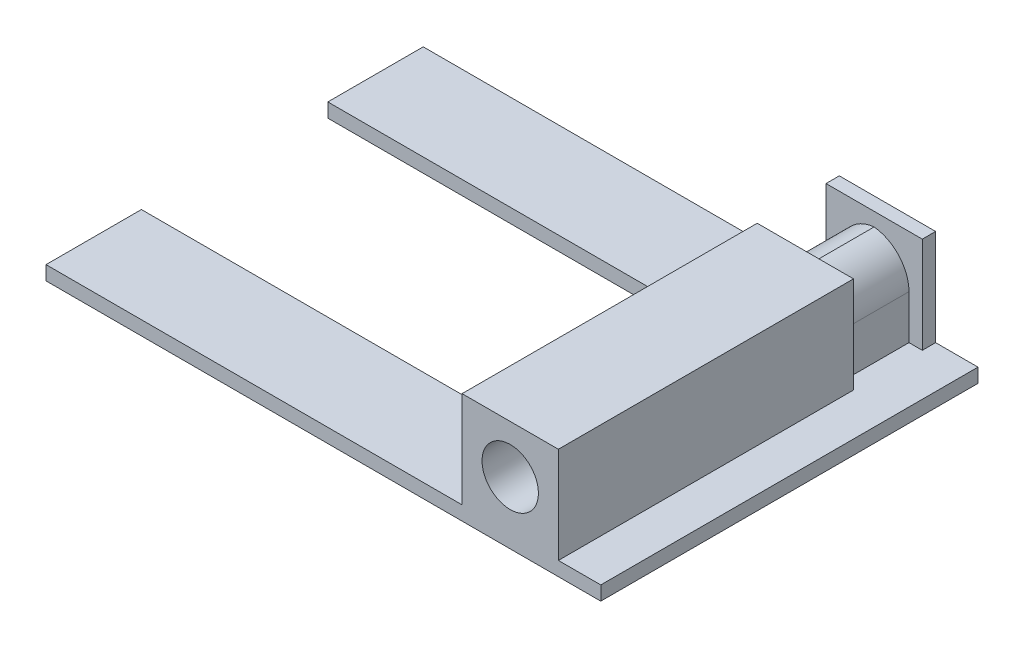
from build123d import *

# Parameters (mm, degrees)
BOSS_EXTRUDE1_DEPTH = 12.7
SKETCH4_W           = 86.8
SKETCH4_H           = 86.8
SKETCH4_R           = 25.4
BOSS_EXTRUDE3_DEPTH = 340
SKETCH6_W           = 86.8
SKETCH6_H           = 62
CUT_EXTRUDE3_DEPTH  = 12
SKETCH7_W           = 62
SKETCH7_H           = 74.8
CUT_EXTRUDE4_DEPTH  = 12
SKETCH8_W           = 62
SKETCH8_H           = 74.8
CUT_EXTRUDE5_DEPTH  = 12
FILLET2_R           = 35


with BuildPart() as part:
    # Sketch1 → Boss-Extrude1 (new body)
    with BuildSketch(Plane(origin=(0, 0, 0), x_dir=(1, 0, 0), z_dir=(0, 1, 0))):
        Polygon((-367.549574024, 171.211944752), (132.450425976, 171.211944752), (132.450425976, -168.788055248), (-367.549574024, -168.788055248), (-367.549574024, -82.788055248), (7.450425976, -82.788055248), (7.450425976, 85.211944752), (-367.549574024, 85.211944752), align=None)
    extrude(amount=BOSS_EXTRUDE1_DEPTH)

    # Sketch4 → Boss-Extrude3 (add)
    with BuildSketch(Plane.XY.offset(168.788055248)):
        with Locations((50.850425976, 56.1)):
            Rectangle(SKETCH4_W, SKETCH4_H)
        with Locations((50.850425976, 56.1)):
            Circle(SKETCH4_R, mode=Mode.SUBTRACT)
    extrude(amount=-BOSS_EXTRUDE3_DEPTH)

    # Sketch6 → Cut-Extrude3 (cut)
    with BuildSketch(Plane(origin=(0, 99.5, 0), x_dir=(1, 0, 0), z_dir=(0, 1, 0))):
        with Locations((50.850425976, 128.211944752)):
            Rectangle(SKETCH6_W, SKETCH6_H)
    extrude(amount=-CUT_EXTRUDE3_DEPTH, mode=Mode.SUBTRACT)

    # Sketch7 → Cut-Extrude4 (cut)
    with BuildSketch(Plane.ZY.offset(-7.450425976)):
        with Locations((-128.211944752, 50.1)):
            Rectangle(SKETCH7_W, SKETCH7_H)
    extrude(amount=-CUT_EXTRUDE4_DEPTH, mode=Mode.SUBTRACT)

    # Sketch8 → Cut-Extrude5 (cut)
    with BuildSketch(Plane(origin=(94.250425976, 0, 0), x_dir=(0, 0, -1), z_dir=(1, 0, 0))):
        with Locations((128.211944752, 50.1)):
            Rectangle(SKETCH8_W, SKETCH8_H)
    extrude(amount=-CUT_EXTRUDE5_DEPTH, mode=Mode.SUBTRACT)

    # Fillet2
    # the kernel refuses this fillet: 35 mm, written as the material it takes off along each edge
    with BuildSketch(Plane(origin=(82.250425976, 87.5, -97.211944752), x_dir=(-1, 0, 0), z_dir=(0, 0, -1))) as fillet2_piece_1:
        with BuildLine():
            CenterArc((FILLET2_R, -FILLET2_R), FILLET2_R, 90, 90)
            Line((0, -FILLET2_R), (0, 0))
            Line((0, 0), (FILLET2_R, 0))
        make_face()
    extrude(amount=62, mode=Mode.SUBTRACT)
    with BuildSketch(Plane(origin=(19.450425976, 87.5, -159.211944752), x_dir=(0, -1, 0), z_dir=(0, 0, 1))) as fillet2_piece_2:
        with BuildLine():
            CenterArc((FILLET2_R, FILLET2_R), FILLET2_R, 180, 90)
            Line((0, FILLET2_R), (0, 0))
            Line((0, 0), (FILLET2_R, 0))
        make_face()
    extrude(amount=62, mode=Mode.SUBTRACT)


solid = part.part
